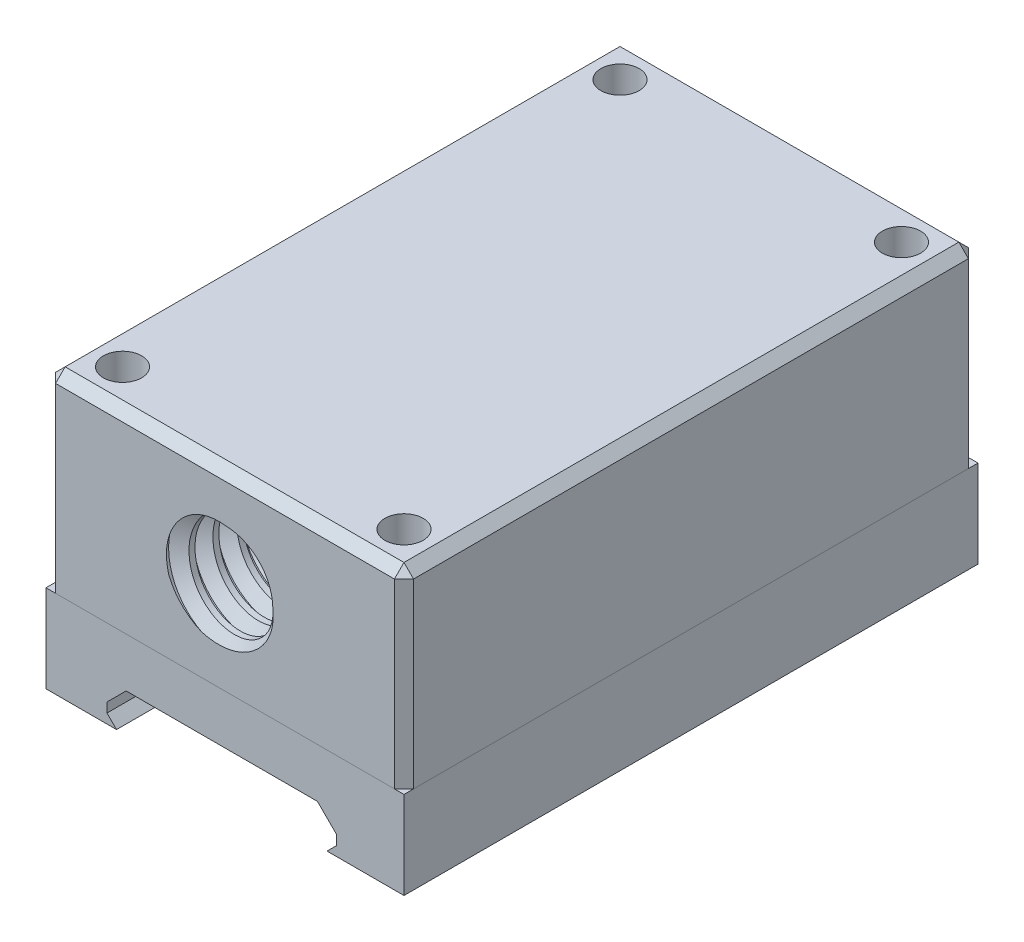
from build123d import *

# Parameters (mm, degrees)
BOSS_EXTRUDE2_DEPTH = 30
SKETCH4_W           = 18.71055111
SKETCH4_H           = 30
BOSS_EXTRUDE3_DEPTH = 10
SKETCH5_R           = 2.5
CUT_EXTRUDE2_DEPTH  = 30
SKETCH6_R           = 1
CUT_EXTRUDE3_DEPTH  = 5
CHAMFER2_SIZE       = 0.5
THREAD2_PITCH       = 1.25


with BuildPart() as part:
    # Sketch2 → Boss-Extrude2 (new body)
    with BuildSketch(Plane.XY):
        Polygon((-0.158265431, 0.513262164), (-0.158265431, 5.089503179), (18.552285679, 5.089503179), (18.552285679, 0.513262164), (14.529443475, 0.513262164), (15.029443475, 1.013262164), (15.029443475, 1.513262164), (14.029443475, 2.513262164), (4.029443475, 2.513262164), (3.029443475, 1.513262164), (3.029443475, 1.013262164), (3.529443475, 0.513262164), align=None)
    extrude(amount=BOSS_EXTRUDE2_DEPTH)


with BuildPart() as body_2:
    # Sketch4 → Boss-Extrude3 (new body)
    with BuildSketch(Plane(origin=(0, 5.089503179, 0), x_dir=(1, 0, 0), z_dir=(0, 1, 0))):
        with Locations((9.197010124, -15)):
            Rectangle(SKETCH4_W, SKETCH4_H)
    extrude(amount=BOSS_EXTRUDE3_DEPTH)

    # Sketch5 → Cut-Extrude2 (cut)
    with BuildSketch(Plane.XY.offset(30)):
        with Locations((9.197010124, 10.089503179)):
            Circle(SKETCH5_R)
    extrude(amount=-CUT_EXTRUDE2_DEPTH, mode=Mode.SUBTRACT)

    # Sketch6 → Cut-Extrude3 (cut)
    with BuildSketch(Plane(origin=(0, 15.089503179, 0), x_dir=(1, 0, 0), z_dir=(0, 1, 0))):
        with Locations(Location((1.841734569, -2, 0), (0, 0, 270))):
            Circle(SKETCH6_R)
        with Locations(Location((16.552285679, -2, 0), (0, 0, 270))):
            Circle(SKETCH6_R)
        with Locations(Location((1.841734569, -28, 0), (0, 0, 270))):
            Circle(SKETCH6_R)
        with Locations(Location((16.552285679, -28, 0), (0, 0, 270))):
            Circle(SKETCH6_R)
    extrude(amount=-CUT_EXTRUDE3_DEPTH, mode=Mode.SUBTRACT)

    # Chamfer2
    chamfer2_edges = [body_2.edges().sort_by_distance(p)[0] for p in [
        (18.552285679, 15.089503179, 15),
        (9.197010124, 15.089503179, 0),
        (-0.158265431, 15.089503179, 15),
        (-0.158265431, 10.089503179, 0),
        (18.552285679, 10.089503179, 0),
        (18.552285679, 10.089503179, 30),
        (-0.158265431, 10.089503179, 30),
        (9.197010124, 15.089503179, 30),
    ]]
    chamfer(chamfer2_edges, length=CHAMFER2_SIZE)

    # Thread2: arcs per turn and ends read off the stored shape
    # Thread2: the profile of Thread Profile3 profile screwed along a right-hand helix through 40 turns, 8 arcs to a turn; built about Z, then put on its axis
    thread2_z = Axis((0, 0, 0), (0, 0, 1))
    thread2_corners = [(2.4997, 0, -0.000173205), (3.176582343, 0, 0.390624998), (3.176582343, 0, 0.546874998), (2.4997, 0, 0.937673202)]
    with BuildLine(mode=Mode.PRIVATE) as thread2_profile:
        Line(thread2_corners[0], thread2_corners[1])
        Line(thread2_corners[1], thread2_corners[2])
        Line(thread2_corners[2], thread2_corners[3])
        Line(thread2_corners[3], thread2_corners[0])
    thread2_cap = Face(thread2_profile.wire())
    thread2_turn_angles = [0, 22.5, 45, 67.5, 90, 112.5, 135, 157.5, 180, 202.5, 225, 247.5, 270, 292.5, 315, 337.5, 360]
    thread2_turn_weights = [1, 0.9238795325112867, 1, 0.9238795325112867, 1, 0.9238795325112867, 1, 0.9238795325112867, 1, 0.9238795325112867, 1, 0.9238795325112867, 1, 0.9238795325112867, 1, 0.9238795325112867, 1]
    thread2_turn_rails = [Edge.make_bspline([Vector(p[0], p[1], 0).rotate(thread2_z, thread2_turn_angles[k]) / thread2_turn_weights[k] + Vector(0, 0, p[2] + THREAD2_PITCH * thread2_turn_angles[k] / 360) for k in range(17)], [0, 0, 0, 1, 1, 2, 2, 3, 3, 4, 4, 5, 5, 6, 6, 7, 7, 8, 8, 8], 2, thread2_turn_weights) for p in thread2_corners]
    thread2_turn_sides = [Face.make_surface_from_curves(thread2_turn_rails[p[0]], thread2_turn_rails[p[1]]) for p in [(0, 1), (1, 2), (2, 3), (3, 0)]]
    thread2 = Plane(origin=(9.197010124, 10.089503179, -10), x_dir=(1, 0, 0), z_dir=(0, 0, 1)) * Solid(Shell([*[p.moved(Location((0, 0, THREAD2_PITCH * i))) for i in range(40) for p in thread2_turn_sides], thread2_cap, thread2_cap.rotate(thread2_z, 14400).moved(Location((0, 0, THREAD2_PITCH * 14400 / 360)))]))
    add(thread2, mode=Mode.SUBTRACT)


solid = Compound([part.part, body_2.part])
